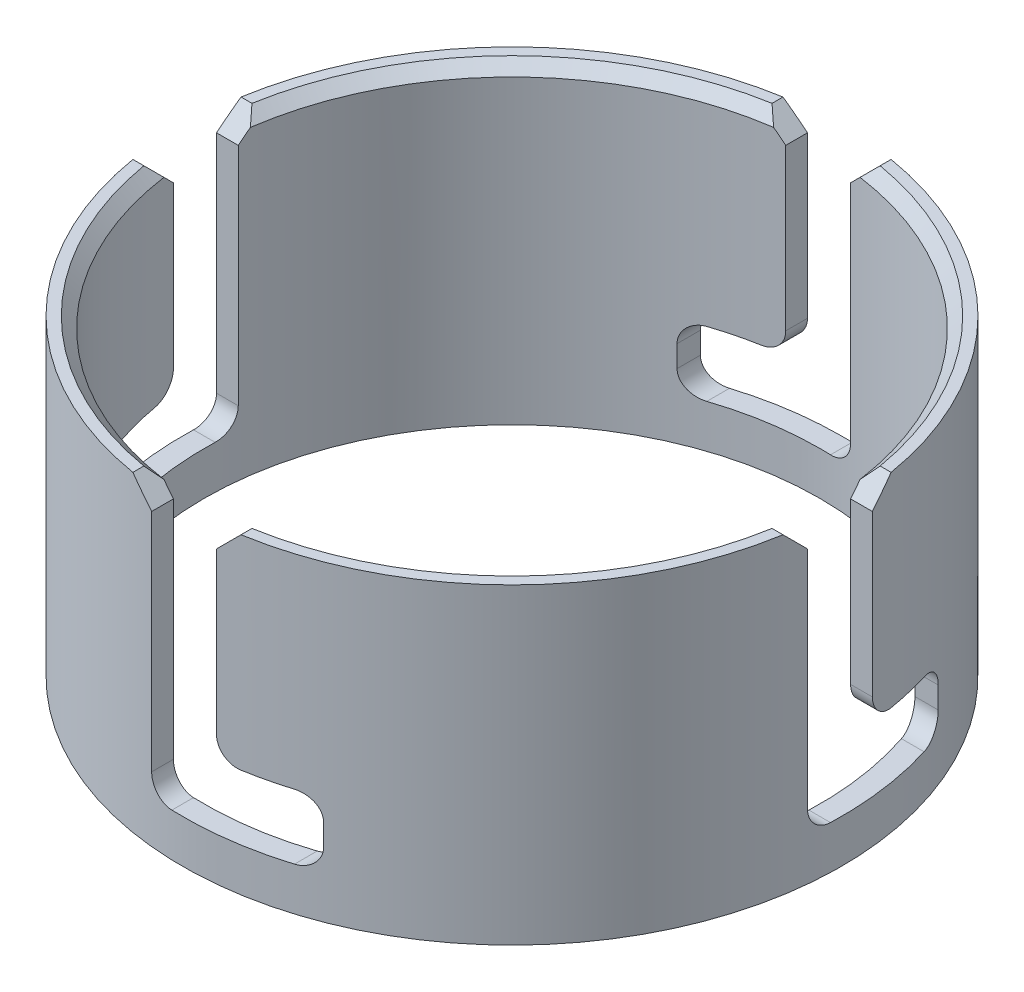
from build123d import *

# Parameters (mm, degrees)
SKETCH2_W                    = 5
SKETCH2_H                    = 72.15
CUT_EXTRUDE1_DEPTH           = 130.68616927
FILLET1_R                    = 5
CHAMFER1_SIZE                = 5
FILLET3_R                    = 5
CIRPATTERN1_COUNT            = 4
FILLET1_OF_CIRPATTERN1_R     = 5
CHAMFER1_OF_CIRPATTERN1_SIZE = 5
FILLET3_OF_CIRPATTERN1_R     = 5
CHAMFER2_SIZE                = 2.5


with BuildPart() as part:
    # Sketch2 → Revolve1 (revolve)
    with BuildSketch(Plane(origin=(0, 0, 0), x_dir=(0, 0, -1), z_dir=(1, 0, 0))):
        with Locations((-73.7, 36.075)):
            Rectangle(SKETCH2_W, SKETCH2_H)
    revolve(axis=Axis((0, -3.6075, 0), (0, 1, 0)))

    # Sketch3 → Cut-Extrude1 (cut, through all)
    with BuildSketch(Plane(origin=(0, 0, 0), x_dir=(0, 0, -1), z_dir=(1, 0, 0))):
        Polygon((-7.5, 72.15), (7.5, 72.15), (7.5, 10), (-27.5, 10), (-27.5, 25), (-7.5, 25), align=None)
    cut_extrude1 = extrude(amount=-CUT_EXTRUDE1_DEPTH, mode=Mode.SUBTRACT)

    # Fillet1
    fillet1_edges = [part.edges().sort_by_distance(p)[0] for p in [
        (-73.316945664, 25, 7.5),
        (-73.316945664, 10, -7.5),
    ]]
    fillet(fillet1_edges, radius=FILLET1_R)

    # Chamfer1
    chamfer1_edges = [part.edges().sort_by_distance(p)[0] for p in [
        (-73.316945664, 72.15, 7.5),
        (-73.316945664, 72.15, -7.5),
    ]]
    chamfer(chamfer1_edges, length=CHAMFER1_SIZE)

    # Fillet3
    fillet3_edges = [part.edges().sort_by_distance(p)[0] for p in [
        (-68.369784942, 25, 27.5),
        (-68.369784942, 10, 27.5),
    ]]
    fillet(fillet3_edges, radius=FILLET3_R)

    # CirPattern1: Cut-Extrude1 ×4 about axis
    cirpattern1_axis = Axis((0, -3.6075, 0), (0, 1, 0))
    for i in range(1, CIRPATTERN1_COUNT):
        add(cut_extrude1.rotate(cirpattern1_axis, i * 360 / CIRPATTERN1_COUNT), mode=Mode.SUBTRACT)

    # Fillet1 of CirPattern1
    fillet1_of_cirpattern1_edges = [part.edges().sort_by_distance(p)[0] for p in [
        (7.5, 25, 73.316945664),
        (-7.5, 10, 73.316945664),
        (73.316945664, 25, -7.5),
        (73.316945664, 10, 7.5),
        (-7.5, 25, -73.316945664),
        (7.5, 10, -73.316945664),
    ]]
    fillet(fillet1_of_cirpattern1_edges, radius=FILLET1_OF_CIRPATTERN1_R)

    # Chamfer1 of CirPattern1
    chamfer1_of_cirpattern1_edges = [part.edges().sort_by_distance(p)[0] for p in [
        (7.5, 72.15, 73.316945664),
        (-7.5, 72.15, 73.316945664),
        (73.316945664, 72.15, -7.5),
        (73.316945664, 72.15, 7.5),
        (-7.5, 72.15, -73.316945664),
        (7.5, 72.15, -73.316945664),
    ]]
    chamfer(chamfer1_of_cirpattern1_edges, length=CHAMFER1_OF_CIRPATTERN1_SIZE)

    # Fillet3 of CirPattern1
    fillet3_of_cirpattern1_edges = [part.edges().sort_by_distance(p)[0] for p in [
        (27.5, 25, 68.369784942),
        (27.5, 10, 68.369784942),
        (68.369784942, 25, -27.5),
        (68.369784942, 10, -27.5),
        (-27.5, 25, -68.369784942),
        (-27.5, 10, -68.369784942),
    ]]
    fillet(fillet3_of_cirpattern1_edges, radius=FILLET3_OF_CIRPATTERN1_R)

    # Chamfer2
    chamfer2_edges = [part.edges().sort_by_distance(p)[0] for p in [
        (-50.34600282, 72.15, -50.34600282),
        (50.34600282, 72.15, -50.34600282),
        (50.34600282, 72.15, 50.34600282),
        (-50.34600282, 72.15, 50.34600282),
    ]]
    chamfer(chamfer2_edges, length=CHAMFER2_SIZE)


solid = part.part
